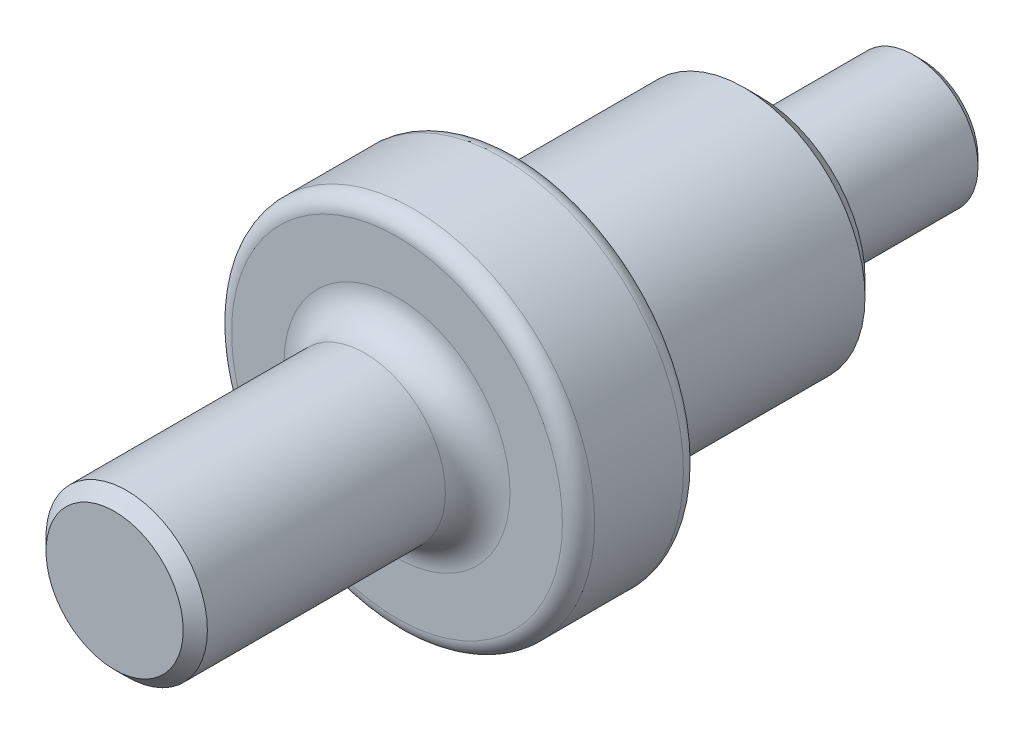
from build123d import *

# Parameters (mm, degrees)
ESBO_O1_R                = 8
RESSALTO_EXTRUS_O1_DEPTH = 20
ESBO_O2_R                = 15
RESSALTO_EXTRUS_O2_DEPTH = 30
ESBO_O3_R                = 22.5
RESSALTO_EXTRUS_O3_DEPTH = 15
ESBO_O4_R                = 10
RESSALTO_EXTRUS_O4_DEPTH = 35
CHANFRO1_SIZE            = 1
CHANFRO2_SIZE            = 2
CHANFRO3_SIZE            = 1.5
FILETE1_R                = 2
FILETE2_R                = 2
FILETE3_R                = 4


with BuildPart() as part:
    # Esboço1 → Ressalto-extrusão1 (new body)
    with BuildSketch(Plane.XY):
        Circle(ESBO_O1_R)
    extrude(amount=RESSALTO_EXTRUS_O1_DEPTH)

    # Esboço2 → Ressalto-extrusão2 (add)
    with BuildSketch(Plane.XY.offset(20)):
        Circle(ESBO_O2_R)
    extrude(amount=RESSALTO_EXTRUS_O2_DEPTH)

    # Esboço3 → Ressalto-extrusão3 (add)
    with BuildSketch(Plane.XY.offset(50)):
        Circle(ESBO_O3_R)
    extrude(amount=RESSALTO_EXTRUS_O3_DEPTH)

    # Esboço4 → Ressalto-extrusão4 (add)
    with BuildSketch(Plane.XY.offset(65)):
        Circle(ESBO_O4_R)
    extrude(amount=RESSALTO_EXTRUS_O4_DEPTH)

    # Chanfro1
    chanfro1_edges = [part.edges().sort_by_distance(p)[0] for p in [
        (-8, 0, 0),
    ]]
    chamfer(chanfro1_edges, length=CHANFRO1_SIZE)

    # Chanfro2
    chanfro2_edges = [part.edges().sort_by_distance(p)[0] for p in [
        (-15, 0, 20),
    ]]
    chamfer(chanfro2_edges, length=CHANFRO2_SIZE)

    # Chanfro3
    chanfro3_edges = [part.edges().sort_by_distance(p)[0] for p in [
        (-10, 0, 100),
    ]]
    chamfer(chanfro3_edges, length=CHANFRO3_SIZE)

    # Filete1
    filete1_edges = [part.edges().sort_by_distance(p)[0] for p in [
        (-22.5, 0, 50),
    ]]
    fillet(filete1_edges, radius=FILETE1_R)

    # Filete2
    filete2_edges = [part.edges().sort_by_distance(p)[0] for p in [
        (-22.5, 0, 65),
    ]]
    fillet(filete2_edges, radius=FILETE2_R)

    # Filete3
    filete3_edges = [part.edges().sort_by_distance(p)[0] for p in [
        (-10, 0, 65),
    ]]
    fillet(filete3_edges, radius=FILETE3_R)


solid = part.part
